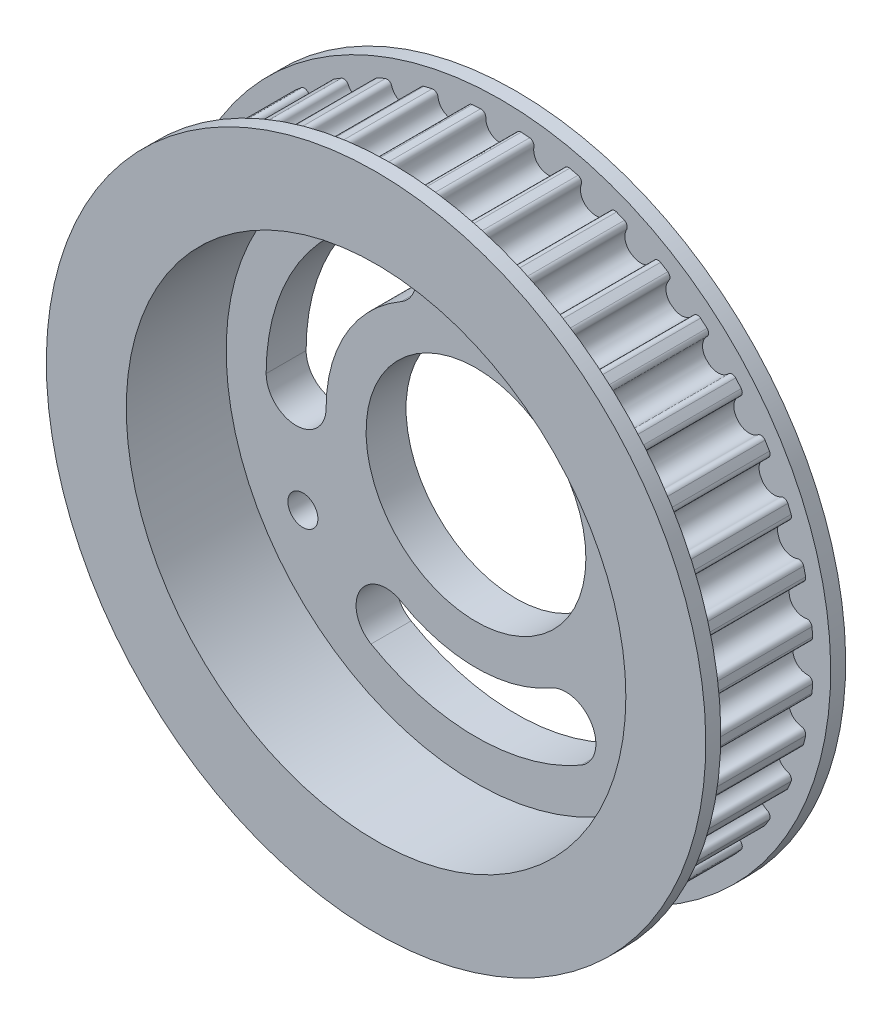
from build123d import *

# Parameters (mm, degrees)
CUT_EXTRUDE_01_DEPTH      = 5.5
PATTERN_CIRCULAR_01_COUNT = 40
SKETCH_696_W              = 14
SKETCH_696_H              = 11
SKETCH_7_R                = 1.5
CUT_EXTRUDE_4_DEPTH       = 49.723710996
SKETCH_8_R                = 25
CUT_EXTRUDE_5_DEPTH       = 10
CUT_EXTRUDE_6_DEPTH       = 48.728398393


with BuildPart() as part:
    # Sketch 01 → 同步带轮01 (revolve)
    with BuildSketch(Plane(origin=(0, 0, 0), x_dir=(0, 0, -1), z_dir=(1, 0, 0))):
        Polygon((7, 0), (7, 33), (5.5, 33), (5.5, 31.259474731), (-5.5, 31.259474731), (-5.5, 33), (-7, 33), (-7, 0), align=None)
    revolve(axis=Axis((0, 0, 7), (0, 0, 1)))

    # Sketch 01 2 → 齿拉伸切除同步带轮01 (cut, symmetric)
    with BuildSketch(Plane.XY):
        with BuildLine():
            ThreePointArc((31.193039128, 2.038865882), (31.259601152, 0), (31.193039128, -2.038865882))
            add(Edge.make_bspline(
                [(31.193039128, -2.038865882), (31.194776913, -2.012319058), (31.194111995, -1.972286092), (31.186725044, -1.91954954), (31.177972892, -1.880581805), (31.166066964, -1.842459179), (31.151086916, -1.805436436), (31.133132836, -1.769761004), (31.11232472, -1.735671302), (31.088801629, -1.703395156), (31.062720769, -1.673148271), (31.03425644, -1.645132783), (31.003598871, -1.619535939), (30.970952951, -1.596528744), (30.936536852, -1.576265181), (30.900580587, -1.558879838), (30.863324423, -1.544492019), (30.825017467, -1.533186249), (30.785915276, -1.525081482), (30.746280852, -1.520069931), (30.699160655, -1.5185581), (30.627744929, -1.519642809), (30.531954075, -1.516025397), (30.419766309, -1.502618406), (30.308964203, -1.4805345), (30.200238466, -1.449806972), (30.094256736, -1.410652655), (29.991672503, -1.363305381), (29.893117585, -1.308058815), (29.799199177, -1.245252775), (29.710495857, -1.175274324), (29.627554091, -1.09855453), (29.55088484, -1.015566038), (29.480960449, -0.926820101), (29.418211615, -0.832863447), (29.363025195, -0.73427489), (29.31574008, -0.631661826), (29.276651638, -0.525656278), (29.245985501, -0.416911781), (29.223987221, -0.306096466), (29.210580967, -0.193899714), (29.207480791, -0.105119728), (29.207768884, -0.040500395), (29.2077087, 0), (29.207768884, 0.040500395), (29.207480791, 0.105119728), (29.210580967, 0.193899714), (29.223987221, 0.306096466), (29.245985501, 0.416911781), (29.276651638, 0.525656278), (29.31574008, 0.631661826), (29.363025195, 0.73427489), (29.418211615, 0.832863447), (29.480960449, 0.926820101), (29.55088484, 1.015566038), (29.627554091, 1.09855453), (29.710495857, 1.175274324), (29.799199177, 1.245252775), (29.893117585, 1.308058815), (29.991672503, 1.363305381), (30.094256736, 1.410652655), (30.200238466, 1.449806972), (30.308964203, 1.4805345), (30.419766309, 1.502618406), (30.531954075, 1.516025397), (30.627744929, 1.519642809), (30.699160655, 1.5185581), (30.746280852, 1.520069931), (30.785915276, 1.525081482), (30.825017467, 1.533186249), (30.863324423, 1.544492019), (30.900580587, 1.558879838), (30.936536852, 1.576265181), (30.970952951, 1.596528744), (31.003598871, 1.619535939), (31.03425644, 1.645132783), (31.062720769, 1.673148271), (31.088801629, 1.703395156), (31.11232472, 1.735671302), (31.133132836, 1.769761004), (31.151086916, 1.805436436), (31.166066964, 1.842459179), (31.177972892, 1.880581805), (31.186725044, 1.91954954), (31.194111995, 1.972286092), (31.194776913, 2.012319058), (31.193039128, 2.038865882)],
                knots=[0, 0, 0, 0, 0.012475647, 0.018713471, 0.024951294, 0.031189118, 0.037426941, 0.043664765, 0.049902589, 0.056140412, 0.062378236, 0.068616059, 0.074853883, 0.081091706, 0.08732953, 0.093567353, 0.099805177, 0.106043001, 0.112280824, 0.118518648, 0.124756471, 0.134376181, 0.152024115, 0.169672048, 0.187319982, 0.204967916, 0.22261585, 0.240263783, 0.257911717, 0.275559651, 0.293207585, 0.310855518, 0.328503452, 0.346151386, 0.36379932, 0.381447253, 0.399095187, 0.416743121, 0.434391055, 0.452038988, 0.469686922, 0.487334856, 0.493667428, 0.5, 0.506332572, 0.512665144, 0.530313078, 0.547961012, 0.565608945, 0.583256879, 0.600904813, 0.618552747, 0.63620068, 0.653848614, 0.671496548, 0.689144482, 0.706792415, 0.724440349, 0.742088283, 0.759736217, 0.77738415, 0.795032084, 0.812680018, 0.830327952, 0.847975885, 0.865623819, 0.875243529, 0.881481352, 0.887719176, 0.893956999, 0.900194823, 0.906432647, 0.91267047, 0.918908294, 0.925146117, 0.931383941, 0.937621764, 0.943859588, 0.950097411, 0.956335235, 0.962573059, 0.968810882, 0.975048706, 0.981286529, 0.987524353, 1, 1, 1, 1], degree=3))
        make_face()
    cut_extrude_01 = extrude(amount=CUT_EXTRUDE_01_DEPTH, both=True, mode=Mode.SUBTRACT)

    # 齿形同步带轮01: 齿拉伸切除同步带轮01 ×40 about axis
    pattern_circular_01_axis = Axis((0, 0, 55), (0, 0, -1))
    for i in range(1, PATTERN_CIRCULAR_01_COUNT):
        add(cut_extrude_01.rotate(pattern_circular_01_axis, i * 360 / PATTERN_CIRCULAR_01_COUNT), mode=Mode.SUBTRACT)

    # Sketch 696 → Cut-Revolve 781 (revolve, cut)
    with BuildSketch(Plane(origin=(0, 0, 0), x_dir=(0, 0, -1), z_dir=(1, 0, 0))):
        with Locations((0, 5.5)):
            Rectangle(SKETCH_696_W, SKETCH_696_H)
    revolve(axis=Axis((0, 0, 7), (0, 0, 1)), mode=Mode.SUBTRACT)

    # 草图7 → 切除-拉伸4 (cut, through all)
    with BuildSketch(Plane.XY.offset(7)):
        with Locations((0, 20)):
            Circle(SKETCH_7_R)
        with Locations((17.320508076, -10)):
            Circle(SKETCH_7_R)
        with Locations((-17.320508076, -10)):
            Circle(SKETCH_7_R)
    extrude(amount=-CUT_EXTRUDE_4_DEPTH, mode=Mode.SUBTRACT)

    # 草图8 → 切除-拉伸5 (cut)
    with BuildSketch(Plane.XY.offset(7)):
        Circle(SKETCH_8_R)
    extrude(amount=-CUT_EXTRUDE_5_DEPTH, mode=Mode.SUBTRACT)

    # 草图9 → 切除-拉伸6 (cut, through all)
    with BuildSketch(Plane.XY.offset(-3)):
        with BuildLine():
            ThreePointArc((-10.5, 18.186533479), (-18.186533479, 10.5), (-21, 0))
            ThreePointArc((-21, 0), (-18, -3), (-15, 0))
            ThreePointArc((-15, 0), (-12.990381057, 7.5), (-7.5, 12.990381057))
            ThreePointArc((-7.5, 12.990381057), (-6.401923789, 17.088457268), (-10.5, 18.186533479))
        make_face()
        with BuildLine():
            ThreePointArc((21, 0), (18.186533479, 10.5), (10.5, 18.186533479))
            ThreePointArc((10.5, 18.186533479), (6.401923789, 17.088457268), (7.5, 12.990381057))
            ThreePointArc((7.5, 12.990381057), (12.990381057, 7.5), (15, 0))
            ThreePointArc((15, 0), (18, -3), (21, 0))
        make_face()
        with BuildLine():
            ThreePointArc((-10.5, -18.186533479), (0, -21), (10.5, -18.186533479))
            ThreePointArc((10.5, -18.186533479), (11.598076211, -14.088457268), (7.5, -12.990381057))
            ThreePointArc((7.5, -12.990381057), (0, -15), (-7.5, -12.990381057))
            ThreePointArc((-7.5, -12.990381057), (-11.598076211, -14.088457268), (-10.5, -18.186533479))
        make_face()
    extrude(amount=-CUT_EXTRUDE_6_DEPTH, mode=Mode.SUBTRACT)


solid = part.part
